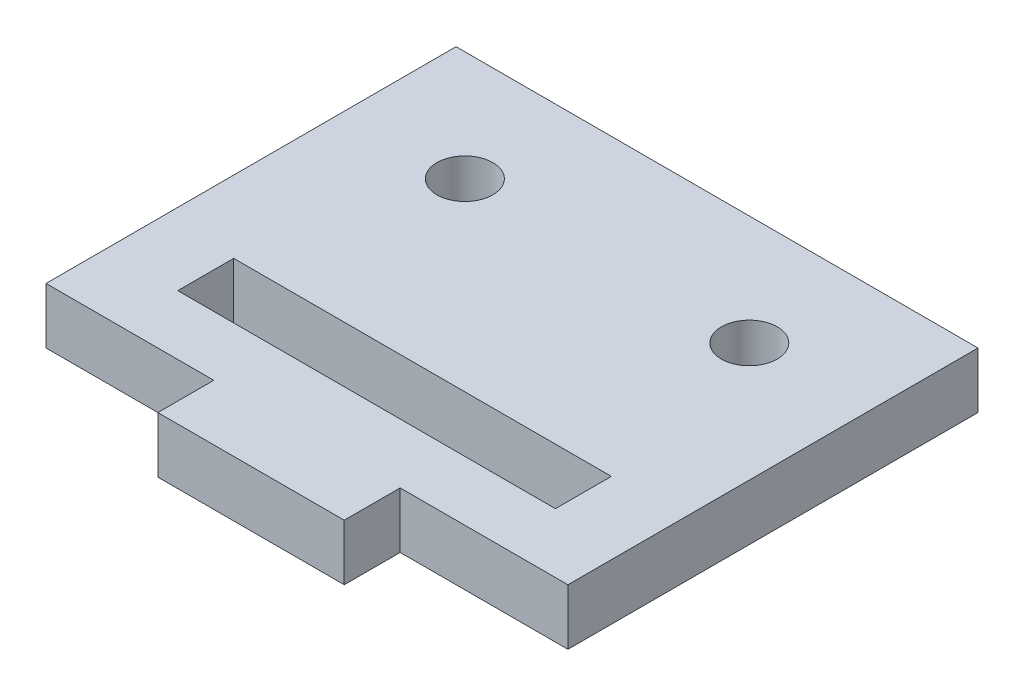
from build123d import *

# Parameters (mm, degrees)
SKETCH1_R           = 1.5
SKETCH1_W           = 20.26
SKETCH1_H           = 3
BOSS_EXTRUDE1_DEPTH = 3


with BuildPart() as part:
    # Sketch1 → Boss-Extrude1 (new body)
    with BuildSketch(Plane(origin=(0, 0, 0), x_dir=(1, 0, 0), z_dir=(0, 1, 0))):
        Polygon((-5, 0), (5, 0), (5, 3), (14, 3), (14, 25), (-14, 25), (-14, 3), (-5, 3), align=None)
        with Locations((7.63, 19.1)):
            Circle(SKETCH1_R, mode=Mode.SUBTRACT)
        with Locations((-7.63, 19.1)):
            Circle(SKETCH1_R, mode=Mode.SUBTRACT)
        with Locations((0, 7.7)):
            Rectangle(SKETCH1_W, SKETCH1_H, mode=Mode.SUBTRACT)
    extrude(amount=BOSS_EXTRUDE1_DEPTH)


solid = part.part
